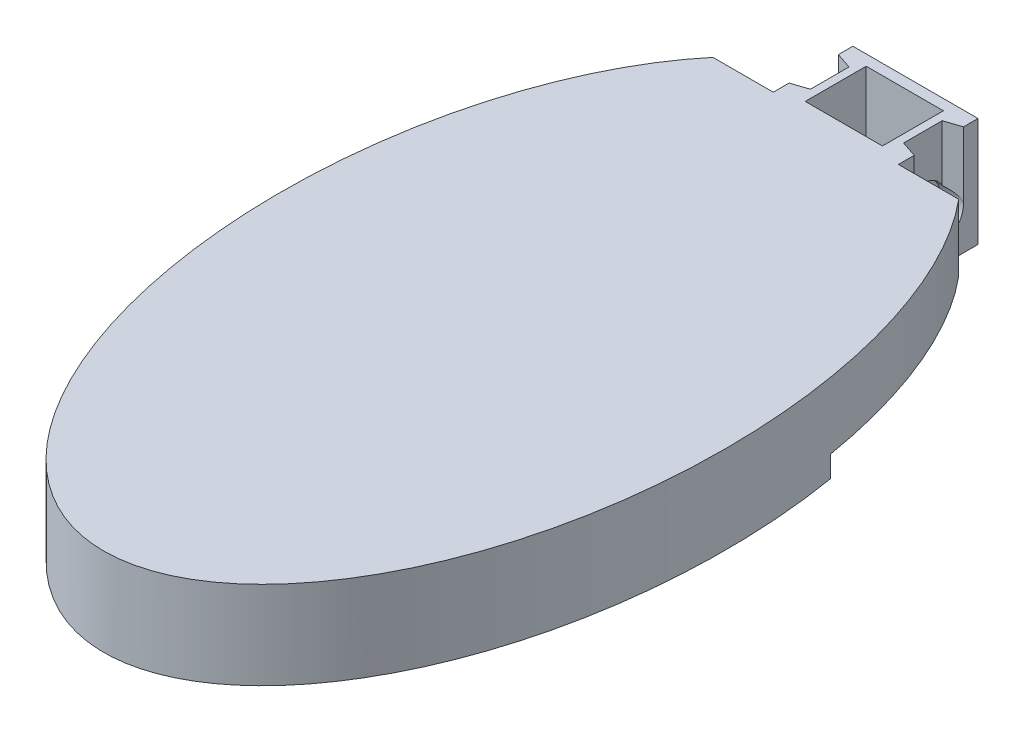
from build123d import *

# Parameters (mm, degrees)
SKETCH1_RX          = 38.1
SKETCH1_RY          = 21.209
BOSS_EXTRUDE1_DEPTH = 6.35
CUT_EXTRUDE6_DEPTH  = 45.065339906
CUT_EXTRUDE8_DEPTH  = 3.81
BOSS_EXTRUDE2_DEPTH = 5.969
CUT_EXTRUDE10_DEPTH = 6.35
CUT_EXTRUDE14_START = -6.35
SKETCH16_W          = 7.366
SKETCH16_H          = 5.8166
CUT_EXTRUDE14_DEPTH = 6.35
BOSS_EXTRUDE3_DEPTH = 3.81
BOSS_EXTRUDE4_DEPTH = 2.032
BOSS_EXTRUDE5_DEPTH = 2.032


# Read off the part's stored shape, not the designer's step: Cut-Extrude10
with BuildPart() as part:
    # Sketch1 → Boss-Extrude1 (new body)
    with BuildSketch(Plane(origin=(0, 0, 0), x_dir=(1, 0, 0), z_dir=(0, 1, 0))):
        with Locations(Location((0, 0), (0, 0, 90))):
            Ellipse(SKETCH1_RX, SKETCH1_RY)
    extrude(amount=BOSS_EXTRUDE1_DEPTH)

    # Sketch7 → Cut-Extrude6 (cut, through all)
    with BuildSketch(Plane(origin=(0, 6.35, 0), x_dir=(1, 0, 0), z_dir=(0, 1, 0))):
        with BuildLine():
            Line((-11.723715863, 31.75), (11.723715863, 31.75))
            add(Edge.make_bspline(
                [(11.723715863, 31.75), (0, 45.72), (-11.723715863, 31.75)],
                knots=[5.697499764, 5.697499764, 5.697499764, 6.868870851, 6.868870851, 6.868870851], degree=2, weights=[1, 0.833333333, 1]))
        make_face()
    extrude(amount=-CUT_EXTRUDE6_DEPTH, mode=Mode.SUBTRACT)

    # Sketch8 → Cut-Extrude8 (cut)
    with BuildSketch(Plane.XZ):
        Polygon((5.969, -31.75), (5.969, -24.1554), (25.250257638, -24.1554), (25.250257638, -46.762779547), (-25.868253854, -46.762779547), (-25.868253854, -24.1554), (-5.969, -24.1554), (-5.969, -31.75), align=None)
    extrude(amount=-CUT_EXTRUDE8_DEPTH, mode=Mode.SUBTRACT)

    # Sketch9 → Boss-Extrude2 (add, symmetric)
    with BuildSketch(Plane(origin=(0, 0, 0), x_dir=(0, 0, -1), z_dir=(1, 0, 0))):
        Polygon((31.75, 6.35), (31.75, -2.032), (31.8516, -2.032), (34.8996, -4.064), (39.3446, -4.064), (39.3446, 6.35), align=None)
    extrude(amount=BOSS_EXTRUDE2_DEPTH, both=True)

    # Sketch10 → Cut-Revolve1 (revolve, cut)
    with BuildSketch(Plane(origin=(5.969, 0, 0), x_dir=(0, 0, -1), z_dir=(1, 0, 0))):
        with BuildLine():
            Line((35.6108, -0.635), (35.6108, 0.635))
            ThreePointArc((35.6108, 0.635), (36.2458, 0), (35.6108, -0.635))
        make_face()
    cut_revolve1 = revolve(axis=Axis((5.969, -0.635, -35.6108), (0, 1, 0)), mode=Mode.SUBTRACT)

    # Sketch14 → Cut-Revolve2 (revolve, cut)
    with BuildSketch(Plane(origin=(0, 0, 0), x_dir=(-1, 0, 0), z_dir=(0, -1, 0))):
        Polygon((-5.969, 33.2613), (-4.064, 33.5788), (-4.064, 35.6108), (-5.969, 35.6108), align=None)
    cut_revolve2 = revolve(axis=Axis((-0.604514271, 0, -35.6108), (1, 0, 0)), mode=Mode.SUBTRACT)

    # Cut-Extrude10 outline → Cut-Extrude10 (cut)
    with BuildSketch(Plane(origin=(0, 6.35, -25.4), x_dir=(-1, 0, 0), z_dir=(0, -1, 0))):
        Polygon((-5.969, 7.8613), (-4.445, 8.3693), (-4.445, 12.0523), (-5.969, 12.5603), align=None)
    cut_extrude10 = extrude(amount=CUT_EXTRUDE10_DEPTH, mode=Mode.SUBTRACT)

    # Mirror1: Cut-Revolve1, Cut-Revolve2, Cut-Extrude10 across plane
    add(cut_revolve1.mirror(Plane(origin=(0, 0, 0), x_dir=(0, 0, 1), z_dir=(1, 0, 0))), mode=Mode.SUBTRACT)
    add(cut_revolve2.mirror(Plane(origin=(0, 0, 0), x_dir=(0, 0, 1), z_dir=(1, 0, 0))), mode=Mode.SUBTRACT)
    add(cut_extrude10.mirror(Plane(origin=(0, 0, 0), x_dir=(0, 0, 1), z_dir=(1, 0, 0))), mode=Mode.SUBTRACT)

    # Sketch16 → Cut-Extrude14 (cut)
    with BuildSketch(Plane(origin=(0, 6.35, 0), x_dir=(1, 0, 0), z_dir=(0, 1, 0)).offset(CUT_EXTRUDE14_START)):
        with Locations((0, 35.4203)):
            Rectangle(SKETCH16_W, SKETCH16_H)
    extrude(amount=CUT_EXTRUDE14_DEPTH, mode=Mode.SUBTRACT)

    # Sketch17 → Boss-Extrude3 (add)
    with BuildSketch(Plane.XZ):
        with BuildLine():
            Line((11.723715863, -31.75), (5.969, -31.75))
            Line((5.969, -31.75), (5.969, -24.1554))
            Line((5.969, -24.1554), (16.401620572, -24.1554))
            add(Edge.make_bspline(
                [(11.723715863, -31.75), (14.380408678, -28.584280269), (16.401620572, -24.1554)],
                knots=[0.585685543, 0.585685543, 0.585685543, 0.884081597, 0.884081597, 0.884081597], degree=2, weights=[1, 0.988890605, 1]))
        make_face()
        with BuildLine():
            Line((-5.969, -24.1554), (-5.969, -31.75))
            Line((-5.969, -31.75), (-11.723715863, -31.75))
            add(Edge.make_bspline(
                [(-16.401620572, -24.1554), (-14.380408678, -28.584280269), (-11.723715863, -31.75)],
                knots=[5.39910371, 5.39910371, 5.39910371, 5.697499764, 5.697499764, 5.697499764], degree=2, weights=[1, 0.988890605, 1]))
            Line((-16.401620572, -24.1554), (-5.969, -24.1554))
        make_face()
    extrude(amount=-BOSS_EXTRUDE3_DEPTH)

    # Sketch18 → Boss-Extrude4 (add)
    with BuildSketch(Plane.XZ):
        with BuildLine():
            Line((-20.318866476, -10.922), (20.318866476, -10.922))
            add(Edge.make_bspline(
                [(20.318866476, -10.922), (28.484392256, 38.1), (0, 38.1), (-28.484392256, 38.1), (-20.318866476, -10.922)],
                knots=[1.28005067, 1.28005067, 1.28005067, 3.141592654, 3.141592654, 5.003134637, 5.003134637, 5.003134637], degree=2, weights=[1, 0.597215762, 1, 0.597215762, 1]))
        make_face()
    extrude(amount=BOSS_EXTRUDE4_DEPTH)

    # Sketch19 → Boss-Extrude5 (add)
    with BuildSketch(Plane.XZ.offset(2.032)):
        with BuildLine():
            Line((-16.000866476, -10.922), (-10.4004959, -27.432))
            Line((-10.4004959, -27.432), (-6.858, -27.432))
            Line((-6.858, -27.432), (-6.858, -21.082))
            ThreePointArc((-6.858, -21.082), (0, -14.224), (6.858, -21.082))
            Line((6.858, -21.082), (6.858, -27.432))
            Line((6.858, -27.432), (10.4004959, -27.432))
            Line((10.4004959, -27.432), (16.000866476, -10.922))
            Line((16.000866476, -10.922), (-16.000866476, -10.922))
        make_face()
    extrude(amount=-BOSS_EXTRUDE5_DEPTH)


solid = part.part
